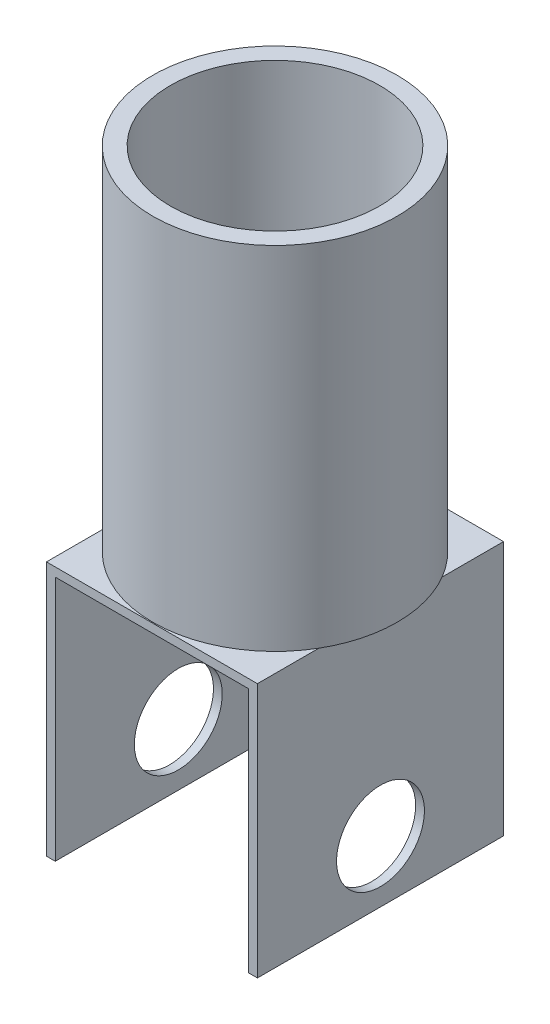
from build123d import *

# Parameters (mm, degrees)
SKETCH1_R               = 69.5
SKETCH1_R_2             = 59.5
BOSS_EXTRUDE1_DEPTH     = 200
SKETCH2_W               = 120
SKETCH2_H               = 140
BOSS_EXTRUDE2_DEPTH     = 5
SKETCH3_W               = 5
SKETCH3_H               = 140
BOSS_EXTRUDE3_DEPTH     = 140
CUT_EXTRUDE1_DEPTH      = 249.334955252
CUT_EXTRUDE1_DEPTH_BACK = 249.334955252
SKETCH4_R               = 25


with BuildPart() as part:
    # Sketch1 → Boss-Extrude1 (new body)
    with BuildSketch(Plane(origin=(0, 0, 0), x_dir=(1, 0, 0), z_dir=(0, 1, 0))):
        Circle(SKETCH1_R)
        Circle(SKETCH1_R_2, mode=Mode.SUBTRACT)
    extrude(amount=BOSS_EXTRUDE1_DEPTH)

    # Sketch2 → Boss-Extrude2 (add)
    with BuildSketch(Plane.XZ):
        Rectangle(SKETCH2_W, SKETCH2_H)
    extrude(amount=BOSS_EXTRUDE2_DEPTH)

    # Sketch3 → Boss-Extrude3 (add)
    with BuildSketch(Plane.XZ.offset(5)):
        with Locations((-57.5, 0)):
            Rectangle(SKETCH3_W, SKETCH3_H)
        with Locations((57.5, 0)):
            Rectangle(SKETCH3_W, SKETCH3_H)
    extrude(amount=BOSS_EXTRUDE3_DEPTH)

    # Sketch4 → Cut-Extrude1 (cut, two sides: drawn at the far end of the back side and taken through both)
    with BuildSketch(Plane.ZY.offset(60).offset(-CUT_EXTRUDE1_DEPTH_BACK)):
        with Locations((0, -110)):
            Circle(SKETCH4_R)
    extrude(amount=CUT_EXTRUDE1_DEPTH + CUT_EXTRUDE1_DEPTH_BACK, mode=Mode.SUBTRACT)


solid = part.part
